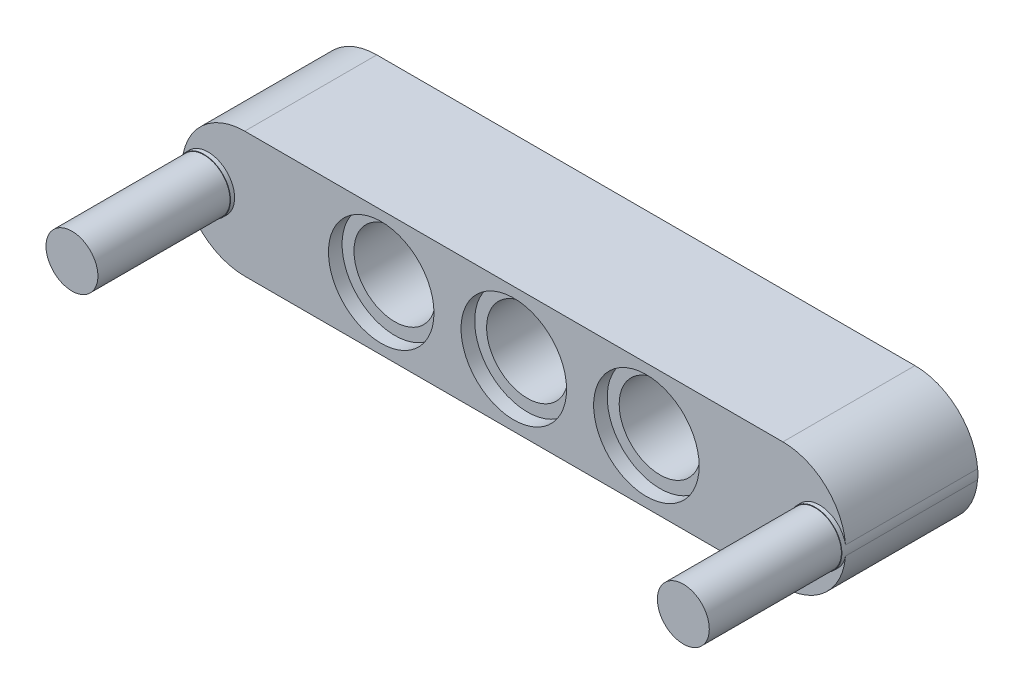
from build123d import *

# Parameters (mm, degrees)
SKETCH1_W                = 39
SKETCH1_H                = 7.38
BOSS_EXTRUDE1_DEPTH      = 7.76
SKETCH2_R                = 2.4
CUT_EXTRUDE1_DEPTH       = 7.76
CUT_EXTRUDE2_OUTLINE_R   = 3.1
CUT_EXTRUDE2_OUTLINE_R_2 = 2.4
CUT_EXTRUDE2_DEPTH       = 0.8
CUT_EXTRUDE3_START       = 6.96
CUT_EXTRUDE3_OUTLINE_R   = 3.1
CUT_EXTRUDE3_OUTLINE_R_2 = 2.4
CUT_EXTRUDE3_DEPTH       = 0.8
LPATTERN3_COUNT          = 3
LPATTERN3_PITCH          = 7.79
LPATTERN6_COUNT          = 3
LPATTERN6_PITCH          = 7.79
FILLET1_R                = 3.69
FILLET2_R                = 3.69
FILLET3_R                = 3.69
FILLET4_R                = 3.69
SKETCH3_R                = 3.1
BOSS_EXTRUDE2_DEPTH      = 7.76
BOSS_EXTRUDE3_START      = -7.76
SKETCH4_R                = 3.1
BOSS_EXTRUDE3_DEPTH      = 7.76
SKETCH11_R               = 1.525
BOSS_EXTRUDE7_DEPTH      = 8
SKETCH12_R               = 1.555
BOSS_EXTRUDE8_DEPTH      = 8
SKETCH14_R               = 1.555
BOSS_EXTRUDE9_DEPTH      = 8


# Read off the part's stored shape, not the designer's step: Cut-Extrude2, Cut-Extrude3
with BuildPart() as part:
    # Sketch1 → Boss-Extrude1 (new body)
    with BuildSketch(Plane.XY):
        with Locations((19.5, 3.69)):
            Rectangle(SKETCH1_W, SKETCH1_H)
    extrude(amount=BOSS_EXTRUDE1_DEPTH)

    # Sketch2 → Cut-Extrude1 (cut)
    with BuildSketch(Plane.XY.offset(7.76)):
        with Locations((19.5, 3.69)):
            Circle(SKETCH2_R)
    cut_extrude1 = extrude(amount=-CUT_EXTRUDE1_DEPTH, mode=Mode.SUBTRACT)

    # Cut-Extrude2 outline → Cut-Extrude2 (cut)
    with BuildSketch(Plane.XY):
        with Locations((19.5, 3.69)):
            Circle(CUT_EXTRUDE2_OUTLINE_R)
        with Locations((19.5, 3.69)):
            Circle(CUT_EXTRUDE2_OUTLINE_R_2, mode=Mode.SUBTRACT)
    cut_extrude2 = extrude(amount=CUT_EXTRUDE2_DEPTH, mode=Mode.SUBTRACT)

    # Cut-Extrude3 outline → Cut-Extrude3 (cut)
    with BuildSketch(Plane.XY.offset(CUT_EXTRUDE3_START)):
        with Locations((19.5, 3.69)):
            Circle(CUT_EXTRUDE3_OUTLINE_R)
        with Locations((19.5, 3.69)):
            Circle(CUT_EXTRUDE3_OUTLINE_R_2, mode=Mode.SUBTRACT)
    cut_extrude3 = extrude(amount=CUT_EXTRUDE3_DEPTH, mode=Mode.SUBTRACT)

    # LPattern3: Cut-Extrude1, Cut-Extrude2, Cut-Extrude3 ×3
    with Locations(*[(-i * LPATTERN3_PITCH, 0, 0) for i in range(1, LPATTERN3_COUNT)]):
        add(cut_extrude1, mode=Mode.SUBTRACT)
        add(cut_extrude2, mode=Mode.SUBTRACT)
        add(cut_extrude3, mode=Mode.SUBTRACT)

    # LPattern6: Cut-Extrude1, Cut-Extrude2, Cut-Extrude3 ×3
    with Locations(*[(i * LPATTERN6_PITCH, 0, 0) for i in range(1, LPATTERN6_COUNT)]):
        add(cut_extrude1, mode=Mode.SUBTRACT)
        add(cut_extrude2, mode=Mode.SUBTRACT)
        add(cut_extrude3, mode=Mode.SUBTRACT)

    # Fillet1
    fillet1_edges = [part.edges().sort_by_distance(p)[0] for p in [
        (0, 7.38, 3.88),
    ]]
    fillet(fillet1_edges, radius=FILLET1_R)

    # Fillet2
    fillet2_edges = [part.edges().sort_by_distance(p)[0] for p in [
        (0, 0, 3.88),
    ]]
    fillet(fillet2_edges, radius=FILLET2_R - 0.0001)  # a hair under: the kernel refuses the full size

    # Fillet3
    fillet3_edges = [part.edges().sort_by_distance(p)[0] for p in [
        (39, 7.38, 3.88),
    ]]
    fillet(fillet3_edges, radius=FILLET3_R)

    # Fillet4
    fillet4_edges = [part.edges().sort_by_distance(p)[0] for p in [
        (39, 0, 3.88),
    ]]
    fillet(fillet4_edges, radius=FILLET4_R - 0.0001)  # a hair under: the kernel refuses the full size

    # Sketch3 → Boss-Extrude2 (add)
    with BuildSketch(Plane(origin=(0, 0, 0), x_dir=(-1, 0, 0), z_dir=(0, 0, -1))):
        with Locations((-35.08, 3.69)):
            Circle(SKETCH3_R)
    extrude(amount=-BOSS_EXTRUDE2_DEPTH)

    # Sketch4 → Boss-Extrude3 (add)
    with BuildSketch(Plane.XY.offset(7.76).offset(BOSS_EXTRUDE3_START)):
        with Locations((3.92, 3.69)):
            Circle(SKETCH4_R)
    extrude(amount=BOSS_EXTRUDE3_DEPTH)

    # Sketch11 → Boss-Extrude7 (add)
    with BuildSketch(Plane.XY.offset(7.76)):
        with Locations(Location((1.54, 3.69, 0), (0, 0, 180))):
            Circle(SKETCH11_R)
        with Locations(Location((37.46, 3.69, 0), (0, 0, 180))):
            Circle(SKETCH11_R)
    extrude(amount=BOSS_EXTRUDE7_DEPTH)

    # Sketch12 → Boss-Extrude8 (add)
    with BuildSketch(Plane(origin=(0, 0, 0), x_dir=(-1, 0, 0), z_dir=(0, 0, -1))):
        with Locations((-37.46, 3.69)):
            Circle(SKETCH12_R)
    extrude(amount=-BOSS_EXTRUDE8_DEPTH)

    # Sketch14 → Boss-Extrude9 (add)
    with BuildSketch(Plane(origin=(0, 0, 0), x_dir=(-1, 0, 0), z_dir=(0, 0, -1))):
        with Locations((-1.54, 3.69)):
            Circle(SKETCH14_R)
    extrude(amount=-BOSS_EXTRUDE9_DEPTH)


solid = part.part
